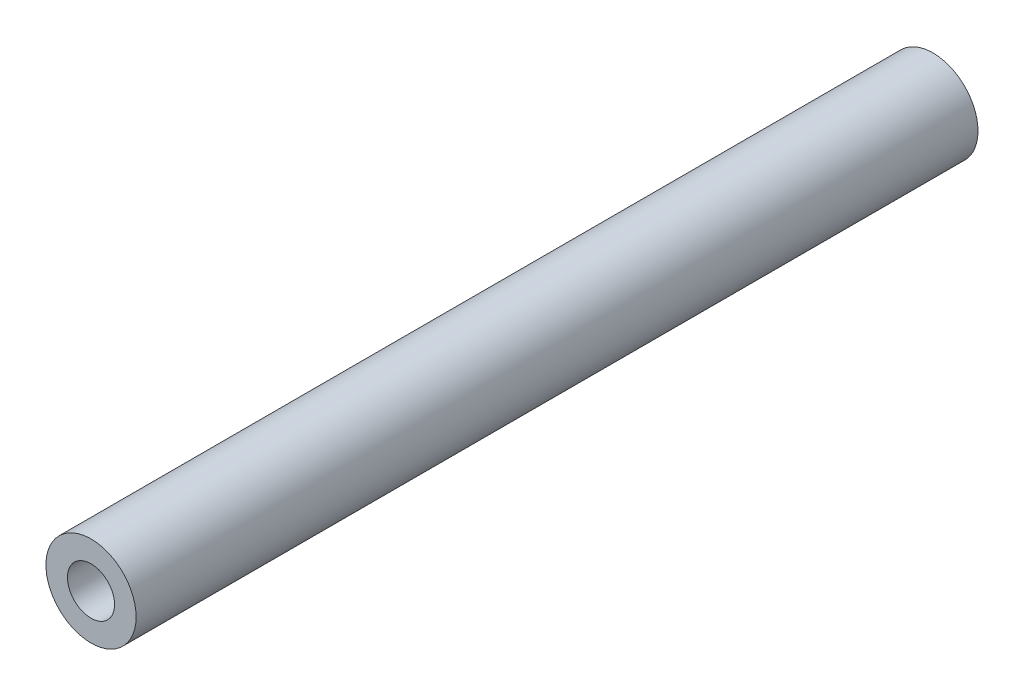
from build123d import *

# Parameters (mm, degrees)
SKETCH1_R           = 4.7625
SKETCH1_R_2         = 2.4892
BOSS_EXTRUDE1_DEPTH = 88.9


with BuildPart() as part:
    # Sketch1 → Boss-Extrude1 (new body)
    with BuildSketch(Plane.XY):
        Circle(SKETCH1_R)
        Circle(SKETCH1_R_2, mode=Mode.SUBTRACT)
    extrude(amount=BOSS_EXTRUDE1_DEPTH)


solid = part.part
